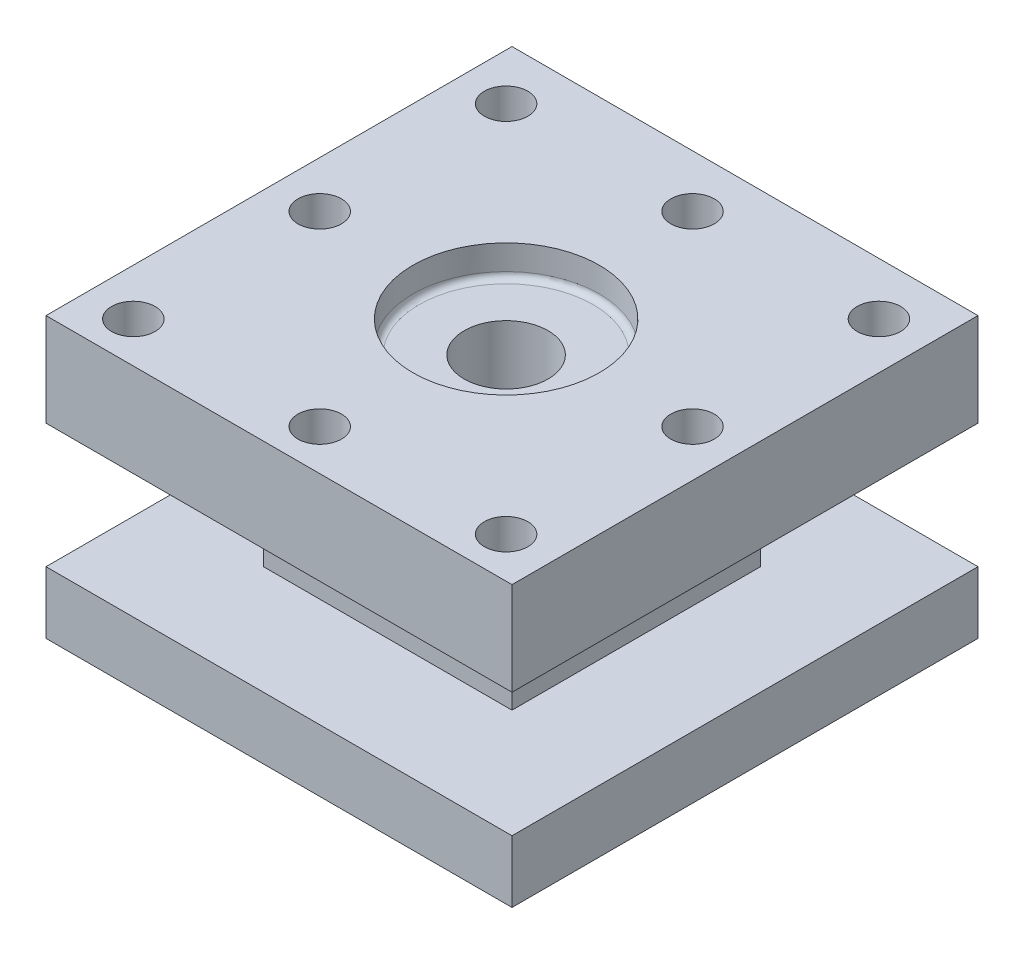
from build123d import *

# Parameters (mm, degrees)
IZIM2_W                     = 150
IZIM2_H                     = 150
Y_KSEKLIK_EKSTR_ZYON1_DEPTH = 30
IZIM3_W                     = 80
IZIM3_H                     = 80
Y_KSEKLIK_EKSTR_ZYON2_DEPTH = 40
IZIM5_W                     = 150
IZIM5_H                     = 150
Y_KSEKLIK_EKSTR_ZYON3_DEPTH = 20
DELIK4_D                    = 27
DELIK4_CBORE_D              = 60
DELIK4_CBORE_DEPTH          = 10
M16_START                   = -30
M16_DI_LI_DELIK1_OUTLINE_R  = 7
M16_DI_LI_DELIK1_DEPTH      = 30
F_10_0_10_AP_DELIK1_D       = 10
F_10_0_10_AP_DELIK1_DEPTH   = 14.995696905
F_10_0_10_AP_DELIK1_TIP     = 3.004303095
RADYUS1_R                   = 3
RADYUS2_R                   = 2


# Read off the part's stored shape, not the designer's step: M16 Dişli Delik1
with BuildPart() as part:
    # Çizim2 → Yükseklik-Ekstrüzyon1 (new body)
    with BuildSketch(Plane(origin=(0, 0, 0), x_dir=(1, 0, 0), z_dir=(0, 1, 0))):
        Rectangle(IZIM2_W, IZIM2_H)
    extrude(amount=-Y_KSEKLIK_EKSTR_ZYON1_DEPTH)

    # Çizim3 → Yükseklik-Ekstrüzyon2 (add)
    with BuildSketch(Plane.XZ.offset(30)):
        Rectangle(IZIM3_W, IZIM3_H)
    extrude(amount=Y_KSEKLIK_EKSTR_ZYON2_DEPTH)

    # Çizim5 → Yükseklik-Ekstrüzyon3 (add)
    with BuildSketch(Plane.XZ.offset(70)):
        Rectangle(IZIM5_W, IZIM5_H)
    extrude(amount=Y_KSEKLIK_EKSTR_ZYON3_DEPTH)

    # Delik4 (through all)
    with Locations(Plane(origin=(0, 0, 1.891621306), x_dir=(0, 0, 1), z_dir=(0, 1, 0))):
        with Locations((0, 0)):
            CounterBoreHole(DELIK4_D / 2, DELIK4_CBORE_D / 2, DELIK4_CBORE_DEPTH)

    # M16 Dişli Delik1 outline → M16 Dişli Delik1 (cut)
    with BuildSketch(Plane(origin=(0, 0, 0), x_dir=(1, 0, 0), z_dir=(0, 1, 0)).offset(M16_START)):
        with Locations((0, -61.891621306)):
            Circle(M16_DI_LI_DELIK1_OUTLINE_R)
        with Locations((60, -1.891621306)):
            Circle(M16_DI_LI_DELIK1_OUTLINE_R)
        with Locations((-60, -1.891621306)):
            Circle(M16_DI_LI_DELIK1_OUTLINE_R)
        with Locations((0, 58.108378694)):
            Circle(M16_DI_LI_DELIK1_OUTLINE_R)
        with Locations((60, 58.108378694)):
            Circle(M16_DI_LI_DELIK1_OUTLINE_R)
        with Locations((-60, -61.891621306)):
            Circle(M16_DI_LI_DELIK1_OUTLINE_R)
        with Locations((-60, 58.108378694)):
            Circle(M16_DI_LI_DELIK1_OUTLINE_R)
        with Locations((60, -61.891621306)):
            Circle(M16_DI_LI_DELIK1_OUTLINE_R)
    extrude(amount=M16_DI_LI_DELIK1_DEPTH, mode=Mode.SUBTRACT)

    # Ø10.0 (10) Çap Delik1
    with Locations(Plane(origin=(0, -90, 0), x_dir=(-1, 0, 0), z_dir=(0, -1, 0))):
        with Locations((0, -1.891621306), (0, 58.108378694), (-60, -1.891621306), (60, -1.891621306), (0, -61.891621306)):
            Hole(F_10_0_10_AP_DELIK1_D / 2, depth=F_10_0_10_AP_DELIK1_DEPTH)
            with Locations((0, 0, -(F_10_0_10_AP_DELIK1_DEPTH + F_10_0_10_AP_DELIK1_TIP / 2))):  # 118° drill point
                Cone(0, F_10_0_10_AP_DELIK1_D / 2, F_10_0_10_AP_DELIK1_TIP, mode=Mode.SUBTRACT)

    # Radyus1
    radyus1_edges = [part.edges().sort_by_distance(p)[0] for p in [
        (40, -30, 0),
        (0, -30, 40),
        (-40, -30, 0),
        (0, -30, -40),
    ]]
    fillet(radyus1_edges, radius=RADYUS1_R)

    # Radyus2
    radyus2_edges = [part.edges().sort_by_distance(p)[0] for p in [
        (0, -10, -28.108378694),
    ]]
    fillet(radyus2_edges, radius=RADYUS2_R)


solid = part.part
